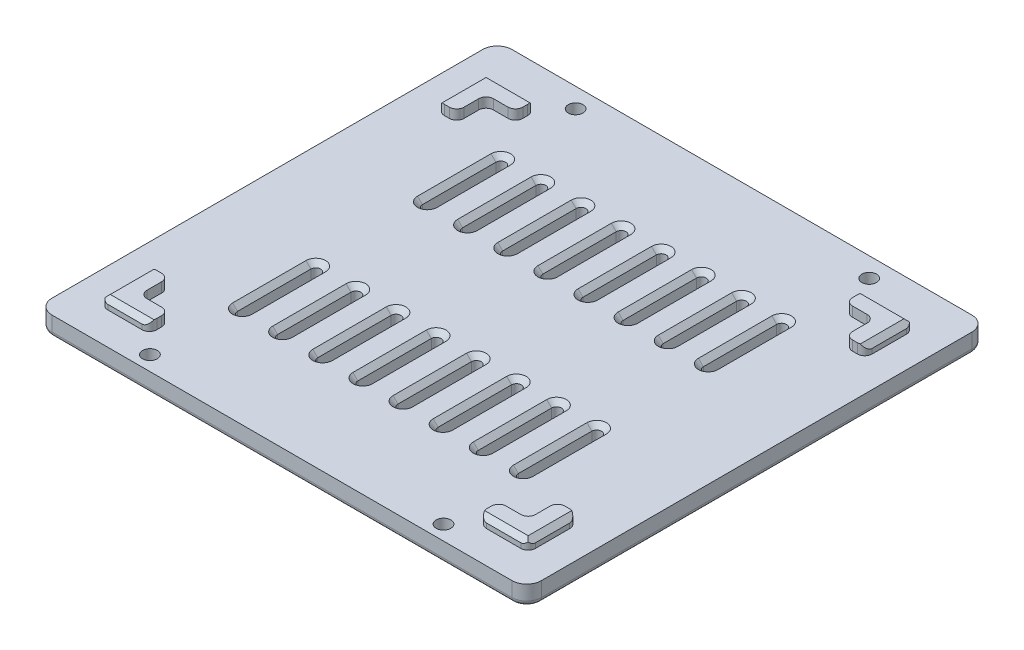
from build123d import *

# Parameters (mm, degrees)
SKETCH_1_W                                           = 100
SKETCH_1_H                                           = 94
EXTRUDE_1_DEPTH                                      = 4
FILLET_1_R                                           = 3
EXTRUDE_2_DEPTH                                      = 2
CBORE_FOR_M2_5_HEX_SOCKET_HEAD_CAP_SCREW_D           = 3
CBORE_FOR_M2_5_HEX_SOCKET_HEAD_CAP_SCREW_DEPTH       = 10
CBORE_FOR_M2_5_HEX_SOCKET_HEAD_CAP_SCREW_CBORE_D     = 5
CBORE_FOR_M2_5_HEX_SOCKET_HEAD_CAP_SCREW_CBORE_DEPTH = 1
CBORE_FOR_M2_5_HEX_SOCKET_HEAD_CAP_SCREW_TIP         = 0.901290929
CUT_EXTRUDE1_DEPTH                                   = 69.738635424
CHAMFER1_SIZE                                        = 1
FILLET_2_R                                           = 1.5
CHAMFER2_SIZE                                        = 1
FILLET1_R                                            = 1


with BuildPart() as part:
    # 草圖1 → 填料-伸長1 (new body)
    with BuildSketch(Plane(origin=(0, 0, 0), x_dir=(1, 0, 0), z_dir=(0, 1, 0))):
        Rectangle(SKETCH_1_W, SKETCH_1_H)
    extrude(amount=EXTRUDE_1_DEPTH)

    # 圓角1
    fillet_1_edges = [part.edges().sort_by_distance(p)[0] for p in [
        (50, 2, 47),
        (-50, 2, 47),
        (-50, 2, -47),
        (50, 2, -47),
    ]]
    fillet(fillet_1_edges, radius=FILLET_1_R)

    # 草圖2 → 填料-伸長2 (add)
    with BuildSketch(Plane(origin=(0, 4, 0), x_dir=(1, 0, 0), z_dir=(0, 1, 0))):
        Polygon((-43.7, -30.4), (-43.7, -40.4), (-33.7, -40.4), (-33.7, -36.4), (-39.7, -36.4), (-39.7, -30.4), align=None)
        Polygon((43.7, -40.4), (33.7, -40.4), (33.7, -36.4), (39.7, -36.4), (39.7, -30.4), (43.7, -30.4), align=None)
        Polygon((-43.7, 28.4), (-43.7, 38.4), (-33.7, 38.4), (-33.7, 34.4), (-39.7, 34.4), (-39.7, 28.4), align=None)
        Polygon((43.7, 38.4), (33.7, 38.4), (33.7, 34.4), (39.7, 34.4), (39.7, 28.4), (43.7, 28.4), align=None)
    extrude(amount=EXTRUDE_2_DEPTH)

    # CBORE for M2.5 Hex Socket Head Cap Screw1
    with Locations(Plane(origin=(0, 0, 0), x_dir=(-1, 0, 0), z_dir=(0, -1, 0))):
        with Locations((-30, 43), (30, 43), (30, -44), (-30, -44)):
            CounterBoreHole(CBORE_FOR_M2_5_HEX_SOCKET_HEAD_CAP_SCREW_D / 2, CBORE_FOR_M2_5_HEX_SOCKET_HEAD_CAP_SCREW_CBORE_D / 2, CBORE_FOR_M2_5_HEX_SOCKET_HEAD_CAP_SCREW_CBORE_DEPTH, depth=CBORE_FOR_M2_5_HEX_SOCKET_HEAD_CAP_SCREW_DEPTH)
            with Locations((0, 0, -(CBORE_FOR_M2_5_HEX_SOCKET_HEAD_CAP_SCREW_DEPTH + CBORE_FOR_M2_5_HEX_SOCKET_HEAD_CAP_SCREW_TIP / 2))):  # 118° drill point
                Cone(0, CBORE_FOR_M2_5_HEX_SOCKET_HEAD_CAP_SCREW_D / 2, CBORE_FOR_M2_5_HEX_SOCKET_HEAD_CAP_SCREW_TIP, mode=Mode.SUBTRACT)

    # Sketch1 → Cut-Extrude1 (cut, through all)
    with BuildSketch(Plane(origin=(0, 4, 0), x_dir=(1, 0, 0), z_dir=(0, 1, 0))):
        with BuildLine():
            Line((-29.7, -26.4), (-29.7, -11.4))
            ThreePointArc((-29.7, -11.4), (-28.7, -10.4), (-27.7, -11.4))
            Line((-27.7, -11.4), (-27.7, -26.4))
            ThreePointArc((-27.7, -26.4), (-28.7, -27.4), (-29.7, -26.4))
        make_face()
        with BuildLine():
            Line((-21.5, -26.4), (-21.5, -11.4))
            ThreePointArc((-21.5, -11.4), (-20.5, -10.4), (-19.5, -11.4))
            Line((-19.5, -11.4), (-19.5, -26.4))
            ThreePointArc((-19.5, -26.4), (-20.5, -27.4), (-21.5, -26.4))
        make_face()
        with BuildLine():
            Line((-13.3, -26.4), (-13.3, -11.4))
            ThreePointArc((-13.3, -11.4), (-12.3, -10.4), (-11.3, -11.4))
            Line((-11.3, -11.4), (-11.3, -26.4))
            ThreePointArc((-11.3, -26.4), (-12.3, -27.4), (-13.3, -26.4))
        make_face()
        with BuildLine():
            Line((-5.1, -26.4), (-5.1, -11.4))
            ThreePointArc((-5.1, -11.4), (-4.1, -10.4), (-3.1, -11.4))
            Line((-3.1, -11.4), (-3.1, -26.4))
            ThreePointArc((-3.1, -26.4), (-4.1, -27.4), (-5.1, -26.4))
        make_face()
        with BuildLine():
            Line((3.1, -26.4), (3.1, -11.4))
            ThreePointArc((3.1, -11.4), (4.1, -10.4), (5.1, -11.4))
            Line((5.1, -11.4), (5.1, -26.4))
            ThreePointArc((5.1, -26.4), (4.1, -27.4), (3.1, -26.4))
        make_face()
        with BuildLine():
            Line((11.3, -26.4), (11.3, -11.4))
            ThreePointArc((11.3, -11.4), (12.3, -10.4), (13.3, -11.4))
            Line((13.3, -11.4), (13.3, -26.4))
            ThreePointArc((13.3, -26.4), (12.3, -27.4), (11.3, -26.4))
        make_face()
        with BuildLine():
            Line((19.5, -26.4), (19.5, -11.4))
            ThreePointArc((19.5, -11.4), (20.5, -10.4), (21.5, -11.4))
            Line((21.5, -11.4), (21.5, -26.4))
            ThreePointArc((21.5, -26.4), (20.5, -27.4), (19.5, -26.4))
        make_face()
        with BuildLine():
            Line((27.7, -26.4), (27.7, -11.4))
            ThreePointArc((27.7, -11.4), (28.7, -10.4), (29.7, -11.4))
            Line((29.7, -11.4), (29.7, -26.4))
            ThreePointArc((29.7, -26.4), (28.7, -27.4), (27.7, -26.4))
        make_face()
        with BuildLine():
            Line((-29.7, 26.4), (-29.7, 11.4))
            ThreePointArc((-29.7, 11.4), (-28.7, 10.4), (-27.7, 11.4))
            Line((-27.7, 11.4), (-27.7, 26.4))
            ThreePointArc((-27.7, 26.4), (-28.7, 27.4), (-29.7, 26.4))
        make_face()
        with BuildLine():
            Line((-21.5, 26.4), (-21.5, 11.4))
            ThreePointArc((-21.5, 11.4), (-20.5, 10.4), (-19.5, 11.4))
            Line((-19.5, 11.4), (-19.5, 26.4))
            ThreePointArc((-19.5, 26.4), (-20.5, 27.4), (-21.5, 26.4))
        make_face()
        with BuildLine():
            Line((-13.3, 26.4), (-13.3, 11.4))
            ThreePointArc((-13.3, 11.4), (-12.3, 10.4), (-11.3, 11.4))
            Line((-11.3, 11.4), (-11.3, 26.4))
            ThreePointArc((-11.3, 26.4), (-12.3, 27.4), (-13.3, 26.4))
        make_face()
        with BuildLine():
            Line((-5.1, 26.4), (-5.1, 11.4))
            ThreePointArc((-5.1, 11.4), (-4.1, 10.4), (-3.1, 11.4))
            Line((-3.1, 11.4), (-3.1, 26.4))
            ThreePointArc((-3.1, 26.4), (-4.1, 27.4), (-5.1, 26.4))
        make_face()
        with BuildLine():
            Line((3.1, 26.4), (3.1, 11.4))
            ThreePointArc((3.1, 11.4), (4.1, 10.4), (5.1, 11.4))
            Line((5.1, 11.4), (5.1, 26.4))
            ThreePointArc((5.1, 26.4), (4.1, 27.4), (3.1, 26.4))
        make_face()
        with BuildLine():
            Line((11.3, 26.4), (11.3, 11.4))
            ThreePointArc((11.3, 11.4), (12.3, 10.4), (13.3, 11.4))
            Line((13.3, 11.4), (13.3, 26.4))
            ThreePointArc((13.3, 26.4), (12.3, 27.4), (11.3, 26.4))
        make_face()
        with BuildLine():
            Line((19.5, 26.4), (19.5, 11.4))
            ThreePointArc((19.5, 11.4), (20.5, 10.4), (21.5, 11.4))
            Line((21.5, 11.4), (21.5, 26.4))
            ThreePointArc((21.5, 26.4), (20.5, 27.4), (19.5, 26.4))
        make_face()
        with BuildLine():
            Line((27.7, 26.4), (27.7, 11.4))
            ThreePointArc((27.7, 11.4), (28.7, 10.4), (29.7, 11.4))
            Line((29.7, 11.4), (29.7, 26.4))
            ThreePointArc((29.7, 26.4), (28.7, 27.4), (27.7, 26.4))
        make_face()
    extrude(amount=-CUT_EXTRUDE1_DEPTH, mode=Mode.SUBTRACT)

    # Chamfer1
    chamfer1_edges = [part.edges().sort_by_distance(p)[0] for p in [
        (-43.7, 6, 35.4),
        (-38.7, 6, 40.4),
        (43.7, 6, 35.4),
        (38.7, 6, 40.4),
        (-38.7, 6, -38.4),
        (-43.7, 6, -33.4),
        (43.7, 6, -33.4),
        (38.7, 6, -38.4),
    ]]
    chamfer(chamfer1_edges, length=CHAMFER1_SIZE)

    # 圓角2
    fillet_2_edges = [part.edges().sort_by_distance(p)[0] for p in [
        (43.7, 4.5, 30.4),
        (39.7, 5, 30.4),
        (39.7, 5, 36.4),
        (33.7, 5, 36.4),
        (33.7, 4.5, 40.4),
        (43.7, 4.5, 40.4),
        (43.7, 4.5, -38.4),
        (33.7, 4.5, -38.4),
        (33.7, 5, -34.4),
        (39.7, 5, -34.4),
        (39.7, 5, -28.4),
        (43.7, 4.5, -28.4),
        (-39.7, 5, -34.4),
        (-33.7, 5, -34.4),
        (-33.7, 4.5, -38.4),
        (-43.7, 4.5, -38.4),
        (-43.7, 4.5, -28.4),
        (-39.7, 5, -28.4),
        (-43.7, 4.5, 30.4),
        (-33.7, 4.5, 40.4),
        (-33.7, 5, 36.4),
        (-39.7, 5, 36.4),
        (-39.7, 5, 30.4),
        (-43.7, 4.5, 40.4),
    ]]
    fillet(fillet_2_edges, radius=FILLET_2_R)

    # Chamfer2
    chamfer2_edges = [part.edges().sort_by_distance(p)[0] for p in [
        (12.3, 0, 27.4),
        (11.3, 0, 18.9),
        (12.3, 0, 10.4),
        (13.3, 0, 18.9),
        (12.3, 4, 27.4),
        (13.3, 4, 18.9),
        (12.3, 4, 10.4),
        (11.3, 4, 18.9),
        (20.5, 0, 27.4),
        (19.5, 0, 18.9),
        (20.5, 0, 10.4),
        (21.5, 0, 18.9),
        (20.5, 4, 27.4),
        (21.5, 4, 18.9),
        (20.5, 4, 10.4),
        (19.5, 4, 18.9),
        (28.7, 0, 27.4),
        (27.7, 0, 18.9),
        (28.7, 0, 10.4),
        (29.7, 0, 18.9),
        (28.7, 4, 27.4),
        (29.7, 4, 18.9),
        (28.7, 4, 10.4),
        (27.7, 4, 18.9),
        (-28.7, 0, -27.4),
        (-27.7, 0, -18.9),
        (-28.7, 0, -10.4),
        (-29.7, 0, -18.9),
        (-28.7, 4, -27.4),
        (-29.7, 4, -18.9),
        (-28.7, 4, -10.4),
        (-27.7, 4, -18.9),
        (4.1, 0, 27.4),
        (3.1, 0, 18.9),
        (4.1, 0, 10.4),
        (5.1, 0, 18.9),
        (4.1, 4, 27.4),
        (5.1, 4, 18.9),
        (4.1, 4, 10.4),
        (3.1, 4, 18.9),
        (-4.1, 0, 27.4),
        (-5.1, 0, 18.9),
        (-4.1, 0, 10.4),
        (-3.1, 0, 18.9),
        (-4.1, 4, 27.4),
        (-3.1, 4, 18.9),
        (-4.1, 4, 10.4),
        (-5.1, 4, 18.9),
        (-12.3, 0, 27.4),
        (-13.3, 0, 18.9),
        (-12.3, 0, 10.4),
        (-11.3, 0, 18.9),
        (-12.3, 4, 27.4),
        (-11.3, 4, 18.9),
        (-12.3, 4, 10.4),
        (-13.3, 4, 18.9),
        (-20.5, 0, 27.4),
        (-21.5, 0, 18.9),
        (-20.5, 0, 10.4),
        (-19.5, 0, 18.9),
        (-20.5, 4, 27.4),
        (-19.5, 4, 18.9),
        (-20.5, 4, 10.4),
        (-21.5, 4, 18.9),
        (-20.5, 0, -27.4),
        (-19.5, 0, -18.9),
        (-20.5, 0, -10.4),
        (-21.5, 0, -18.9),
        (-20.5, 4, -27.4),
        (-21.5, 4, -18.9),
        (-20.5, 4, -10.4),
        (-19.5, 4, -18.9),
        (-12.3, 0, -27.4),
        (-11.3, 0, -18.9),
        (-12.3, 0, -10.4),
        (-13.3, 0, -18.9),
        (-12.3, 4, -27.4),
        (-13.3, 4, -18.9),
        (-12.3, 4, -10.4),
        (-11.3, 4, -18.9),
        (-4.1, 0, -27.4),
        (-3.1, 0, -18.9),
        (-4.1, 0, -10.4),
        (-5.1, 0, -18.9),
        (-4.1, 4, -27.4),
        (-5.1, 4, -18.9),
        (-4.1, 4, -10.4),
        (-3.1, 4, -18.9),
        (4.1, 0, -27.4),
        (5.1, 0, -18.9),
        (4.1, 0, -10.4),
        (3.1, 0, -18.9),
        (4.1, 4, -27.4),
        (3.1, 4, -18.9),
        (4.1, 4, -10.4),
        (5.1, 4, -18.9),
        (12.3, 0, -27.4),
        (13.3, 0, -18.9),
        (12.3, 0, -10.4),
        (11.3, 0, -18.9),
        (12.3, 4, -27.4),
        (11.3, 4, -18.9),
        (12.3, 4, -10.4),
        (13.3, 4, -18.9),
        (20.5, 0, -27.4),
        (21.5, 0, -18.9),
        (20.5, 0, -10.4),
        (19.5, 0, -18.9),
        (20.5, 4, -27.4),
        (19.5, 4, -18.9),
        (20.5, 4, -10.4),
        (21.5, 4, -18.9),
        (28.7, 0, -27.4),
        (29.7, 0, -18.9),
        (28.7, 0, -10.4),
        (27.7, 0, -18.9),
        (28.7, 4, -27.4),
        (27.7, 4, -18.9),
        (28.7, 4, -10.4),
        (29.7, 4, -18.9),
        (-28.7, 0, 27.4),
        (-29.7, 0, 18.9),
        (-28.7, 0, 10.4),
        (-27.7, 0, 18.9),
        (-28.7, 4, 27.4),
        (-27.7, 4, 18.9),
        (-28.7, 4, 10.4),
        (-29.7, 4, 18.9),
    ]]
    chamfer(chamfer2_edges, length=CHAMFER2_SIZE)

    # Fillet1
    # the kernel refuses this fillet: 1 mm, written as the material it takes off along each edge
    with BuildSketch(Plane(origin=(50, 0, 44), x_dir=(0, 1, 0), z_dir=(0, 0, -1)), Plane(origin=(-50, 0, -44), x_dir=(0, 1, 0), z_dir=(0, 0, 1))) as fillet1_piece_1:
        with BuildLine():
            CenterArc((FILLET1_R, -FILLET1_R), FILLET1_R, 90, 90)
            Line((0, -FILLET1_R), (0, 0))
            Line((0, 0), (FILLET1_R, 0))
        make_face()
    extrude(amount=88, mode=Mode.SUBTRACT)
    with BuildSketch(Plane(origin=(-47, 0, 47), x_dir=(0, 1, 0), z_dir=(1, 0, 0)), Plane(origin=(47, 0, -47), x_dir=(0, 1, 0), z_dir=(-1, 0, 0))) as fillet1_piece_2:
        with BuildLine():
            CenterArc((FILLET1_R, -FILLET1_R), FILLET1_R, 90, 90)
            Line((0, -FILLET1_R), (0, 0))
            Line((0, 0), (FILLET1_R, 0))
        make_face()
    extrude(amount=94, mode=Mode.SUBTRACT)
    with BuildSketch(Plane(origin=(-47, 0, -44), x_dir=(0, 0, -1), z_dir=(1, 0, 0))) as fillet1_piece_3:
        with BuildLine():
            CenterArc((3 - FILLET1_R, FILLET1_R), FILLET1_R, 270, 90)
            Line((3 - FILLET1_R, 0), (3, 0))
            Line((3, 0), (3, FILLET1_R))
        make_face()
    revolve(axis=Axis((-47, 0, -44), (0, 1, 0)), revolution_arc=90, mode=Mode.SUBTRACT)
    with BuildSketch(Plane(origin=(47, 0, -44), x_dir=(1, 0, 0), z_dir=(0, 0, 1))) as fillet1_piece_4:
        with BuildLine():
            CenterArc((3 - FILLET1_R, FILLET1_R), FILLET1_R, 270, 90)
            Line((3 - FILLET1_R, 0), (3, 0))
            Line((3, 0), (3, FILLET1_R))
        make_face()
    revolve(axis=Axis((47, 0, -44), (0, 1, 0)), revolution_arc=90, mode=Mode.SUBTRACT)
    with BuildSketch(Plane(origin=(-47, 0, 44), x_dir=(0, 0, 1), z_dir=(1, 0, 0))) as fillet1_piece_5:
        with BuildLine():
            CenterArc((3 - FILLET1_R, -FILLET1_R), FILLET1_R, 0, 90)
            Line((3 - FILLET1_R, 0), (3, 0))
            Line((3, 0), (3, -FILLET1_R))
        make_face()
    revolve(axis=Axis((-47, 0, 44), (0, -1, 0)), revolution_arc=90, mode=Mode.SUBTRACT)
    with BuildSketch(Plane(origin=(47, 0, 44), x_dir=(0, 0, 1), z_dir=(-1, 0, 0))) as fillet1_piece_6:
        with BuildLine():
            CenterArc((3 - FILLET1_R, FILLET1_R), FILLET1_R, 270, 90)
            Line((3 - FILLET1_R, 0), (3, 0))
            Line((3, 0), (3, FILLET1_R))
        make_face()
    revolve(axis=Axis((47, 0, 44), (0, 1, 0)), revolution_arc=90, mode=Mode.SUBTRACT)


solid = part.part
